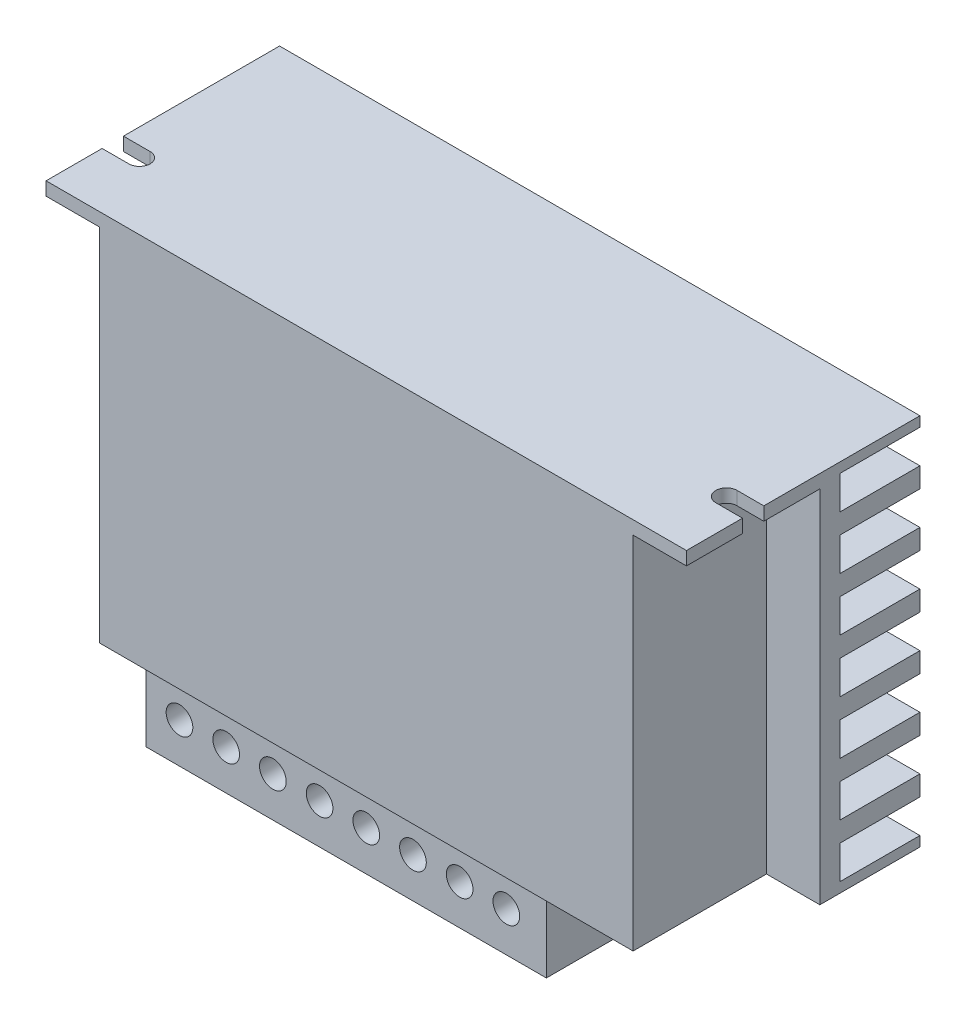
from build123d import *

# Parameters (mm, degrees)
SKETCH_1_W          = 96
SKETCH_1_H          = 56
EXTRUDE_1_DEPTH     = 35
SKETCH_5_W          = 20
SKETCH_5_H          = 54
CUT_EXTRUDE_3_DEPTH = 8
SKETCH_6_W          = 20
SKETCH_6_H          = 54
CUT_EXTRUDE_4_DEPTH = 8
SKETCH_7_W          = 12
SKETCH_7_H          = 5
CUT_EXTRUDE_5_DEPTH = 117.520384483
CUT_EXTRUDE_7_DEPTH = 116.572488076
SKETCH_9_W          = 60
SKETCH_9_H          = 15
EXTRUDE_2_DEPTH     = 12
SKETCH_10_R         = 2
CUT_EXTRUDE_8_DEPTH = 3
SKETCH_11_R         = 2.1
CUT_EXTRUDE_9_DEPTH = 15


with BuildPart() as part:
    # Эскиз1 → Бобышка-Вытянуть1 (new body)
    with BuildSketch(Plane.XY):
        with Locations((48, 28)):
            Rectangle(SKETCH_1_W, SKETCH_1_H)
    extrude(amount=EXTRUDE_1_DEPTH)

    # Эскиз5 → Вырез-Вытянуть3 (cut)
    with BuildSketch(Plane(origin=(96, 0, 0), x_dir=(0, 0, -1), z_dir=(1, 0, 0))):
        with Locations((-25, 27)):
            Rectangle(SKETCH_5_W, SKETCH_5_H)
    extrude(amount=-CUT_EXTRUDE_3_DEPTH, mode=Mode.SUBTRACT)

    # Эскиз6 → Вырез-Вытянуть4 (cut)
    with BuildSketch(Plane.ZY):
        with Locations((25, 27)):
            Rectangle(SKETCH_6_W, SKETCH_6_H)
    extrude(amount=-CUT_EXTRUDE_4_DEPTH, mode=Mode.SUBTRACT)

    # Эскиз7 → Вырез-Вытянуть5 (cut, through all)
    with BuildSketch(Plane(origin=(96, 0, 0), x_dir=(0, 0, -1), z_dir=(1, 0, 0))):
        with Locations((-6, 4)):
            Rectangle(SKETCH_7_W, SKETCH_7_H)
        with Locations((-6, 12)):
            Rectangle(SKETCH_7_W, SKETCH_7_H)
        with Locations((-6, 20)):
            Rectangle(SKETCH_7_W, SKETCH_7_H)
        with Locations((-6, 28)):
            Rectangle(SKETCH_7_W, SKETCH_7_H)
        with Locations((-6, 36)):
            Rectangle(SKETCH_7_W, SKETCH_7_H)
        with Locations((-6, 44)):
            Rectangle(SKETCH_7_W, SKETCH_7_H)
        with Locations((-6, 52)):
            Rectangle(SKETCH_7_W, SKETCH_7_H)
    extrude(amount=-CUT_EXTRUDE_5_DEPTH, mode=Mode.SUBTRACT)

    # Эскиз8 → Вырез-Вытянуть7 (cut, through all)
    with BuildSketch(Plane.XZ.offset(-54)):
        with BuildLine():
            Line((96, 26.6), (92, 26.6))
            ThreePointArc((92, 26.6), (90.4, 25), (92, 23.4))
            Line((92, 23.4), (96, 23.4))
            Line((96, 23.4), (96, 26.6))
        make_face()
        with BuildLine():
            Line((0, 23.4), (4, 23.4))
            ThreePointArc((4, 23.4), (5.6, 25), (4, 26.6))
            Line((4, 26.6), (0, 26.6))
            Line((0, 26.6), (0, 23.4))
        make_face()
    extrude(amount=-CUT_EXTRUDE_7_DEPTH, mode=Mode.SUBTRACT)

    # Эскиз9 → Бобышка-Вытянуть2 (add)
    with BuildSketch(Plane.XZ):
        with Locations((43, 25.5)):
            Rectangle(SKETCH_9_W, SKETCH_9_H)
    extrude(amount=EXTRUDE_2_DEPTH)

    # Эскиз10 → Вырез-Вытянуть8 (cut)
    with BuildSketch(Plane.XY.offset(33)):
        with Locations((18, -6)):
            Circle(SKETCH_10_R)
        with Locations((25, -6)):
            Circle(SKETCH_10_R)
        with Locations((32, -6)):
            Circle(SKETCH_10_R)
        with Locations((39, -6)):
            Circle(SKETCH_10_R)
        with Locations((46, -6)):
            Circle(SKETCH_10_R)
        with Locations((53, -6)):
            Circle(SKETCH_10_R)
        with Locations((60, -6)):
            Circle(SKETCH_10_R)
        with Locations((67, -6)):
            Circle(SKETCH_10_R)
    extrude(amount=-CUT_EXTRUDE_8_DEPTH, mode=Mode.SUBTRACT)

    # Эскиз11 → Вырез-Вытянуть9 (cut)
    with BuildSketch(Plane(origin=(0, 0, 0), x_dir=(-1, 0, 0), z_dir=(0, 0, -1))):
        with Locations((-23, 13)):
            Circle(SKETCH_11_R)
        with Locations((-73, 13)):
            Circle(SKETCH_11_R)
    extrude(amount=-CUT_EXTRUDE_9_DEPTH, mode=Mode.SUBTRACT)


solid = part.part
